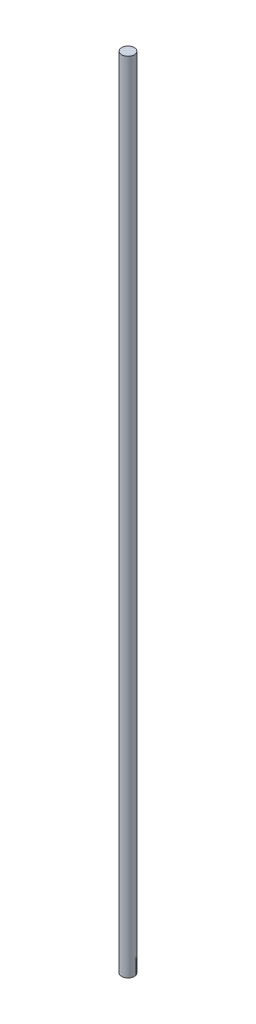
from build123d import *

# Parameters (mm, degrees)
SKETCH1_R           = 1.5
BOSS_EXTRUDE1_DEPTH = 95.25


with BuildPart() as part:
    # Sketch1 → Boss-Extrude1 (new, symmetric)
    with BuildSketch(Plane(origin=(0, 0, 0), x_dir=(1, 0, 0), z_dir=(0, 1, 0))):
        Circle(SKETCH1_R)
    extrude(amount=BOSS_EXTRUDE1_DEPTH, both=True)


solid = part.part
